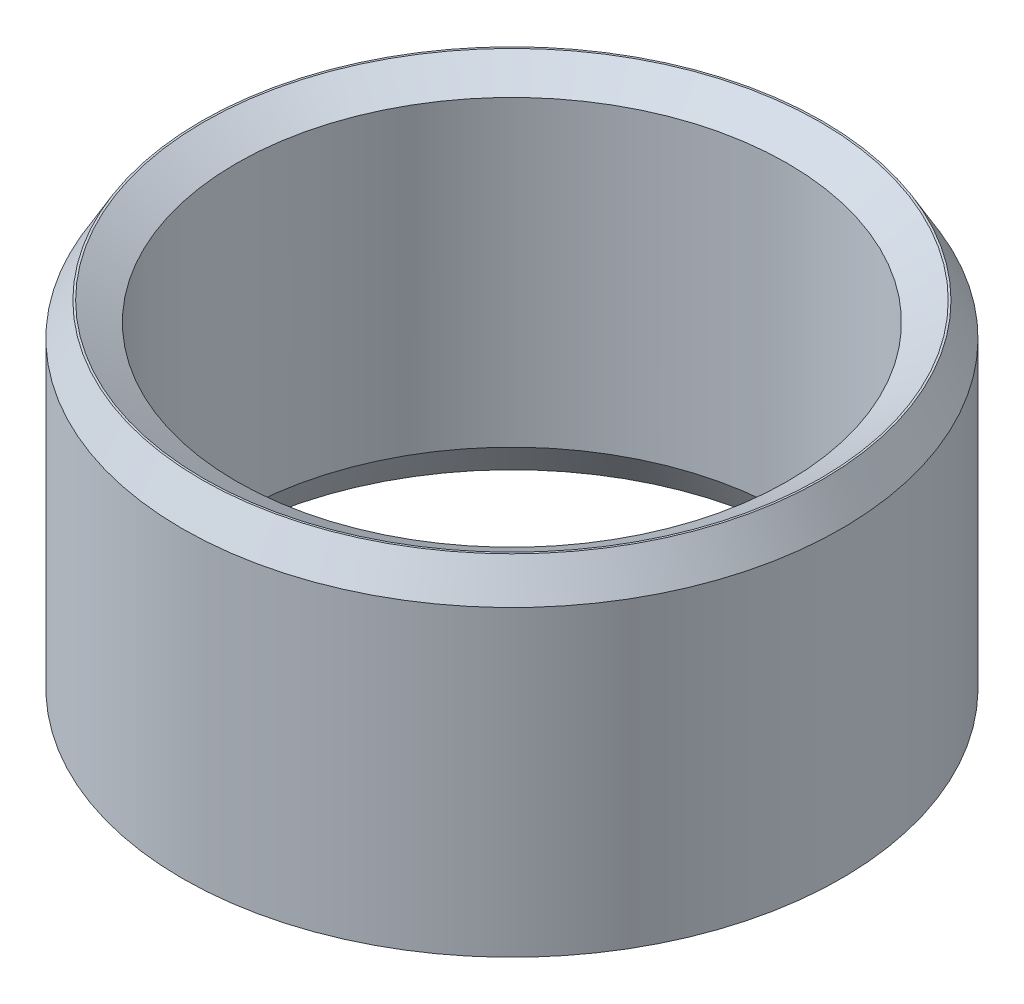
from build123d import *
from OCP.BRepFilletAPI import BRepFilletAPI_MakeChamfer

# Parameters (mm, degrees)
SKETCH1_R           = 35
BOSS_EXTRUDE1_DEPTH = 37.703772147
SKETCH2_R           = 29.254393763
CUT_EXTRUDE1_DEPTH  = 63.221977099
CHAMFER1_SIZE       = 3.510693751
CHAMFER1_SIZE2      = 2.026899982


with BuildPart() as part:
    # Sketch1 → Boss-Extrude1 (new body)
    with BuildSketch(Plane(origin=(0, 0, 0), x_dir=(1, 0, 0), z_dir=(0, 1, 0))):
        Circle(SKETCH1_R)
    extrude(amount=BOSS_EXTRUDE1_DEPTH)

    # Sketch2 → Cut-Extrude1 (cut, through all)
    with BuildSketch(Plane(origin=(0, 0, 0), x_dir=(1, 0, 0), z_dir=(0, 1, 0))):
        Circle(SKETCH2_R)
    extrude(amount=CUT_EXTRUDE1_DEPTH, mode=Mode.SUBTRACT)

    # Chamfer1: one chamfer whose edges measure the first distance from different faces: ONE call of the kernel's chamfer builder (chamfer() names one face for all edges)
    chamfer1_edges_1 = [part.edges().sort_by_distance(p)[0] for p in [
        (-29.254393763, 37.703772147, 0),
    ]]
    chamfer1_side_1 = [part.faces().sort_by_distance(p)[0] for p in [
        (-34.010050506, 37.703772147, 0),
    ]]
    chamfer1_edges_2 = [part.edges().sort_by_distance(p)[0] for p in [
        (-29.254393763, 0, 0),
    ]]
    chamfer1_side_2 = [part.faces().sort_by_distance(p)[0] for p in [
        (-29.254393763, 18.851886074, 0),
    ]]
    chamfer1_edges_3 = [part.edges().sort_by_distance(p)[0] for p in [
        (-35, 0, 0),
    ]]
    chamfer1_side_3 = [part.faces().sort_by_distance(p)[0] for p in [
        (-34.010050506, 0, 0),
    ]]
    chamfer1_edges_4 = [part.edges().sort_by_distance(p)[0] for p in [
        (-35, 37.703772147, 0),
    ]]
    chamfer1_side_4 = [part.faces().sort_by_distance(p)[0] for p in [
        (-35, 18.851886074, 0),
    ]]
    chamfer1 = BRepFilletAPI_MakeChamfer(part.part.solid().wrapped)
    for e in chamfer1_edges_1:
        chamfer1.Add(CHAMFER1_SIZE, CHAMFER1_SIZE2, e.wrapped, chamfer1_side_1[0].wrapped)  # the first distance lies on this face
    for e in chamfer1_edges_2:
        chamfer1.Add(CHAMFER1_SIZE, CHAMFER1_SIZE2, e.wrapped, chamfer1_side_2[0].wrapped)  # the first distance lies on this face
    for e in chamfer1_edges_3:
        chamfer1.Add(CHAMFER1_SIZE, CHAMFER1_SIZE2, e.wrapped, chamfer1_side_3[0].wrapped)  # the first distance lies on this face
    for e in chamfer1_edges_4:
        chamfer1.Add(CHAMFER1_SIZE, CHAMFER1_SIZE2, e.wrapped, chamfer1_side_4[0].wrapped)  # the first distance lies on this face
    add(Compound.cast(chamfer1.Shape()), mode=Mode.REPLACE)


solid = part.part
